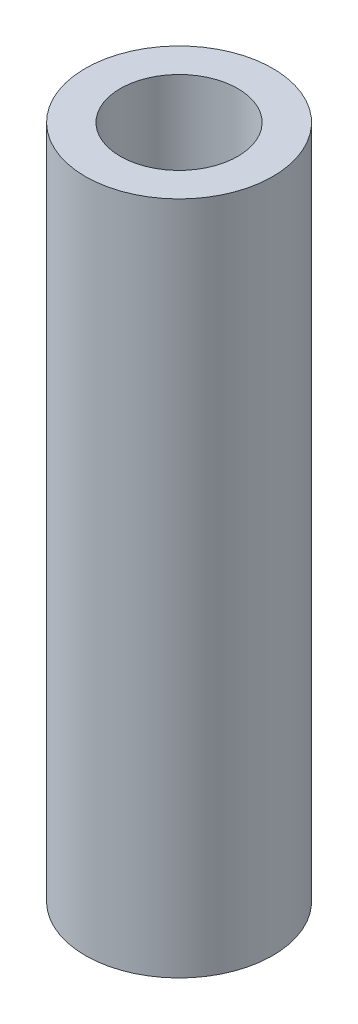
from build123d import *

# Parameters (mm, degrees)
SKETCH1_R                  = 3.96875
BOSS_EXTRUDE1_DEPTH        = 28.575
F_9_0_196_DIAMETER_HOLE1_D = 4.9784


with BuildPart() as part:
    # Sketch1 → Boss-Extrude1 (new body)
    with BuildSketch(Plane(origin=(0, 0, 0), x_dir=(-1, 0, 0), z_dir=(0, 1, 0))):
        Circle(SKETCH1_R)
    extrude(amount=BOSS_EXTRUDE1_DEPTH)

    # #9 (0.196) Diameter Hole1 (through all)
    with Locations(Plane(origin=(0, 28.575, 0), x_dir=(-1, 0, 0), z_dir=(0, 1, 0))):
        with Locations((0, 0)):
            Hole(F_9_0_196_DIAMETER_HOLE1_D / 2)


solid = part.part
